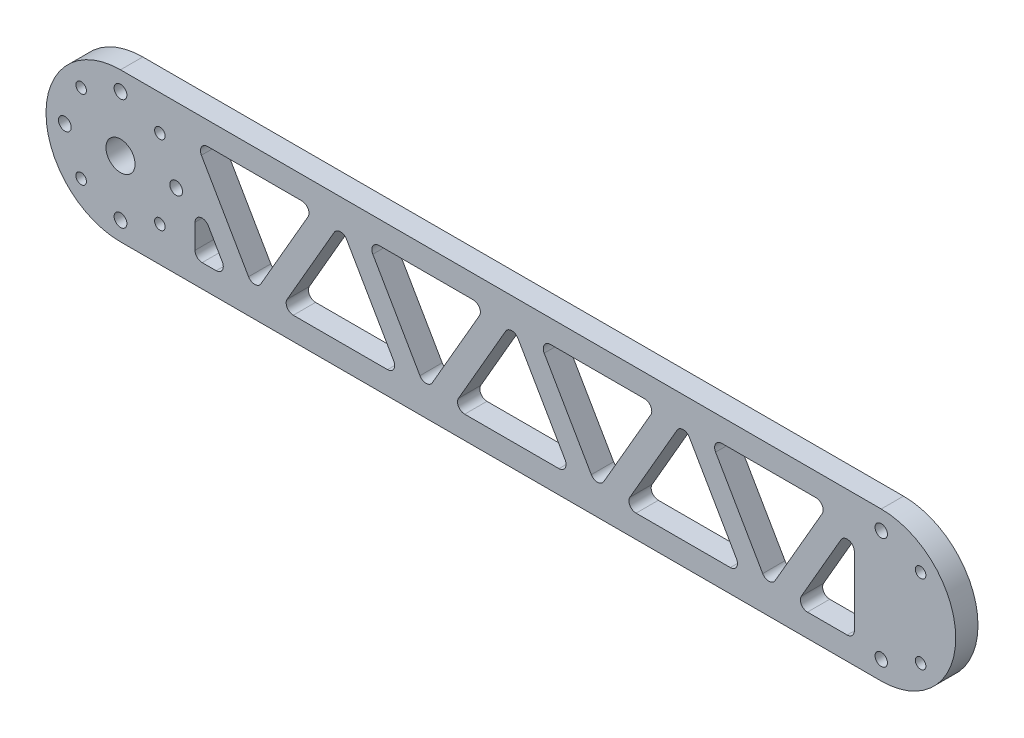
from build123d import *

# Parameters (mm, degrees)
SKETCH1_R              = 4
SKETCH1_R_2            = 1.75
SKETCH1_R_3            = 1.5
SKETCH1_R_4            = 1.8
BOSS_EXTRUDE1_DEPTH    = 6
CUT_EXTRUDE1_DEPTH     = 226.966811722
FILLET1_R              = 2
MOVE_FACE1_OUTLINE_R   = 4
MOVE_FACE1_OUTLINE_R_2 = 3.92
MOVE_FACE1_OUTLINE_R_3 = 1.75
MOVE_FACE1_OUTLINE_R_4 = 1.67
MOVE_FACE1_OUTLINE_R_5 = 1.5
MOVE_FACE1_OUTLINE_R_6 = 1.42
MOVE_FACE1_OUTLINE_R_7 = 1.8
MOVE_FACE1_OUTLINE_R_8 = 1.72
MOVE_FACE1_DEPTH       = 6


# Read off the part's stored shape, not the designer's step: Move Face1
with BuildPart() as part:
    # Sketch1 → Boss-Extrude1 (new body)
    with BuildSketch(Plane.XY):
        with BuildLine():
            Line((0, -20), (205, -20))
            ThreePointArc((205, -20), (225, 0), (205, 20))
            Line((205, 20), (0, 20))
            ThreePointArc((0, 20), (-20, 0), (0, -20))
        make_face()
        Circle(SKETCH1_R, mode=Mode.SUBTRACT)
        with Locations((205, -15)):
            Circle(SKETCH1_R_2, mode=Mode.SUBTRACT)
        with Locations((215.606601718, -10.606601718)):
            Circle(SKETCH1_R_3, mode=Mode.SUBTRACT)
        with Locations((205, 15)):
            Circle(SKETCH1_R_2, mode=Mode.SUBTRACT)
        with Locations((215.606601718, 10.606601718)):
            Circle(SKETCH1_R_3, mode=Mode.SUBTRACT)
        with Locations((0, -15)):
            Circle(SKETCH1_R_4, mode=Mode.SUBTRACT)
        with Locations((10.606601718, -10.606601718)):
            Circle(SKETCH1_R_3, mode=Mode.SUBTRACT)
        with Locations((-15, 0)):
            Circle(SKETCH1_R_4, mode=Mode.SUBTRACT)
        with Locations((-10.606601718, -10.606601718)):
            Circle(SKETCH1_R_3, mode=Mode.SUBTRACT)
        with Locations((0, 15)):
            Circle(SKETCH1_R_4, mode=Mode.SUBTRACT)
        with Locations((-10.606601718, 10.606601718)):
            Circle(SKETCH1_R_3, mode=Mode.SUBTRACT)
        with Locations((15, 0)):
            Circle(SKETCH1_R_4, mode=Mode.SUBTRACT)
        with Locations((10.606601718, 10.606601718)):
            Circle(SKETCH1_R_3, mode=Mode.SUBTRACT)
    extrude(amount=BOSS_EXTRUDE1_DEPTH)

    # Sketch2 → Cut-Extrude1 (cut, through all)
    with BuildSketch(Plane.XY.offset(6)):
        Polygon((20, 14), (52.331615075, 14), (36.165807537, -14), align=None)
        Polygon((43.094010768, -14), (59.259818305, 14), (75.425625842, -14), align=None)
        Polygon((66.188021535, 14), (82.353829072, -14), (98.51963661, 14), align=None)
        Polygon((89.282032303, -14), (105.44783984, 14), (121.613647377, -14), align=None)
        Polygon((112.37604307, 14), (128.541850608, -14), (144.707658145, 14), align=None)
        Polygon((20, 2), (20, -14), (29.237604307, -14), align=None)
        Polygon((135.470053838, -14), (151.635861375, 14), (167.801668913, -14), align=None)
        Polygon((174.729872143, -14), (158.564064606, 14), (190.89567968, 14), align=None)
        Polygon((181.658075373, -14), (197.82388291, 14), (197.82388291, -14), align=None)
    extrude(amount=-CUT_EXTRUDE1_DEPTH, mode=Mode.SUBTRACT)

    # Fillet1
    fillet1_edges = [part.edges().sort_by_distance(p)[0] for p in [
        (121.613647377, -14, 3),
        (89.282032303, -14, 3),
        (105.44783984, 14, 3),
        (112.37604307, 14, 3),
        (144.707658145, 14, 3),
        (128.541850608, -14, 3),
        (20, 2, 3),
        (29.237604307, -14, 3),
        (20, -14, 3),
        (167.801668913, -14, 3),
        (135.470053838, -14, 3),
        (151.635861375, 14, 3),
        (190.89567968, 14, 3),
        (174.729872143, -14, 3),
        (158.564064606, 14, 3),
        (197.82388291, -14, 3),
        (181.658075373, -14, 3),
        (197.82388291, 14, 3),
        (36.165807537, -14, 3),
        (20, 14, 3),
        (52.331615075, 14, 3),
        (75.425625842, -14, 3),
        (43.094010768, -14, 3),
        (59.259818305, 14, 3),
        (66.188021535, 14, 3),
        (98.51963661, 14, 3),
        (82.353829072, -14, 3),
    ]]
    fillet(fillet1_edges, radius=FILLET1_R)

    # Move Face1 outline → Move Face1 (add)
    # profile 1 of 23: a face of its own
    with BuildSketch(Plane.XY):
        with BuildLine():
            ThreePointArc((0, 20.08), (-20.08, 0), (0, -20.08))
            Line((0, -20.08), (205, -20.08))
            ThreePointArc((205, -20.08), (225.08, 0), (205, 20.08))
            Line((205, 20.08), (0, 20.08))
        make_face()
        with BuildLine():
            Line((205, -20), (0, -20))
            ThreePointArc((0, -20), (-20, 0), (0, 20))
            Line((0, 20), (205, 20))
            ThreePointArc((205, 20), (225, 0), (205, -20))
        make_face(mode=Mode.SUBTRACT)
    # profile 2 of 23: a face of its own
    with BuildSketch(Plane.XY):
        Circle(MOVE_FACE1_OUTLINE_R)
        Circle(MOVE_FACE1_OUTLINE_R_2, mode=Mode.SUBTRACT)
    # profile 3 of 23: a face of its own
    with BuildSketch(Plane.XY):
        with Locations((205, -15)):
            Circle(MOVE_FACE1_OUTLINE_R_3)
        with Locations((205, -15)):
            Circle(MOVE_FACE1_OUTLINE_R_4, mode=Mode.SUBTRACT)
    # profile 4 of 23: a face of its own
    with BuildSketch(Plane.XY):
        with Locations((215.606601718, -10.606601718)):
            Circle(MOVE_FACE1_OUTLINE_R_5)
        with Locations((215.606601718, -10.606601718)):
            Circle(MOVE_FACE1_OUTLINE_R_6, mode=Mode.SUBTRACT)
    # profile 5 of 23: a face of its own
    with BuildSketch(Plane.XY):
        with Locations((205, 15)):
            Circle(MOVE_FACE1_OUTLINE_R_3)
        with Locations((205, 15)):
            Circle(MOVE_FACE1_OUTLINE_R_4, mode=Mode.SUBTRACT)
    # profile 6 of 23: a face of its own
    with BuildSketch(Plane.XY):
        with Locations((215.606601718, 10.606601718)):
            Circle(MOVE_FACE1_OUTLINE_R_5)
        with Locations((215.606601718, 10.606601718)):
            Circle(MOVE_FACE1_OUTLINE_R_6, mode=Mode.SUBTRACT)
    # profile 7 of 23: a face of its own
    with BuildSketch(Plane.XY):
        with Locations((0, -15)):
            Circle(MOVE_FACE1_OUTLINE_R_7)
        with Locations((0, -15)):
            Circle(MOVE_FACE1_OUTLINE_R_8, mode=Mode.SUBTRACT)
    # profile 8 of 23: a face of its own
    with BuildSketch(Plane.XY):
        with Locations((10.606601718, -10.606601718)):
            Circle(MOVE_FACE1_OUTLINE_R_5)
        with Locations((10.606601718, -10.606601718)):
            Circle(MOVE_FACE1_OUTLINE_R_6, mode=Mode.SUBTRACT)
    # profile 9 of 23: a face of its own
    with BuildSketch(Plane.XY):
        with Locations((-15, 0)):
            Circle(MOVE_FACE1_OUTLINE_R_7)
        with Locations((-15, 0)):
            Circle(MOVE_FACE1_OUTLINE_R_8, mode=Mode.SUBTRACT)
    # profile 10 of 23: a face of its own
    with BuildSketch(Plane.XY):
        with Locations((-10.606601718, -10.606601718)):
            Circle(MOVE_FACE1_OUTLINE_R_5)
        with Locations((-10.606601718, -10.606601718)):
            Circle(MOVE_FACE1_OUTLINE_R_6, mode=Mode.SUBTRACT)
    # profile 11 of 23: a face of its own
    with BuildSketch(Plane.XY):
        with Locations((0, 15)):
            Circle(MOVE_FACE1_OUTLINE_R_7)
        with Locations((0, 15)):
            Circle(MOVE_FACE1_OUTLINE_R_8, mode=Mode.SUBTRACT)
    # profile 12 of 23: a face of its own
    with BuildSketch(Plane.XY):
        with Locations((-10.606601718, 10.606601718)):
            Circle(MOVE_FACE1_OUTLINE_R_5)
        with Locations((-10.606601718, 10.606601718)):
            Circle(MOVE_FACE1_OUTLINE_R_6, mode=Mode.SUBTRACT)
    # profile 13 of 23: a face of its own
    with BuildSketch(Plane.XY):
        with Locations((15, 0)):
            Circle(MOVE_FACE1_OUTLINE_R_7)
        with Locations((15, 0)):
            Circle(MOVE_FACE1_OUTLINE_R_8, mode=Mode.SUBTRACT)
    # profile 14 of 23: a face of its own
    with BuildSketch(Plane.XY):
        with Locations((10.606601718, 10.606601718)):
            Circle(MOVE_FACE1_OUTLINE_R_5)
        with Locations((10.606601718, 10.606601718)):
            Circle(MOVE_FACE1_OUTLINE_R_6, mode=Mode.SUBTRACT)
    # profile 15 of 23: a face of its own
    with BuildSketch(Plane.XY):
        with BuildLine():
            ThreePointArc((23.464101615, 14), (21.732050808, 13), (21.732050808, 11))
            Line((21.732050808, 11), (34.43375673, -11))
            ThreePointArc((34.43375673, -11), (36.165807538, -12), (37.897858345, -11))
            Line((37.897858345, -11), (50.599564267, 11))
            ThreePointArc((50.599564267, 11), (50.599564267, 13), (48.867513459, 14))
            Line((48.867513459, 14), (23.464101615, 14))
        make_face()
        with BuildLine():
            Line((34.503038762, -10.96), (21.80133284, 11.04))
            ThreePointArc((21.80133284, 11.04), (21.80133284, 12.96), (23.464101615, 13.92))
            Line((23.464101615, 13.92), (48.867513459, 13.92))
            ThreePointArc((48.867513459, 13.92), (50.530282235, 12.96), (50.530282235, 11.04))
            Line((50.530282235, 11.04), (37.828576313, -10.96))
            ThreePointArc((37.828576313, -10.96), (36.165807538, -11.92), (34.503038762, -10.96))
        make_face(mode=Mode.SUBTRACT)
    # profile 16 of 23: a face of its own
    with BuildSketch(Plane.XY):
        with BuildLine():
            ThreePointArc((96.787585802, 11), (96.787585802, 13), (95.055534995, 14))
            Line((95.055534995, 14), (69.65212315, 14))
            ThreePointArc((69.65212315, 14), (67.920072343, 13), (67.920072343, 11))
            Line((67.920072343, 11), (80.621778265, -11))
            ThreePointArc((80.621778265, -11), (82.353829072, -12), (84.08587988, -11))
            Line((84.08587988, -11), (96.787585802, 11))
        make_face()
        with BuildLine():
            Line((69.65212315, 13.92), (95.055534995, 13.92))
            ThreePointArc((95.055534995, 13.92), (96.71830377, 12.96), (96.71830377, 11.04))
            Line((96.71830377, 11.04), (84.016597848, -10.96))
            ThreePointArc((84.016597848, -10.96), (82.353829073, -11.92), (80.691060297, -10.96))
            Line((80.691060297, -10.96), (67.989354375, 11.04))
            ThreePointArc((67.989354375, 11.04), (67.989354375, 12.96), (69.65212315, 13.92))
        make_face(mode=Mode.SUBTRACT)
    # profile 17 of 23: a face of its own
    with BuildSketch(Plane.XY):
        with BuildLine():
            ThreePointArc((142.975607337, 11), (142.975607337, 13), (141.24355653, 14))
            Line((141.24355653, 14), (115.840144685, 14))
            ThreePointArc((115.840144685, 14), (114.108093878, 13), (114.108093878, 11))
            Line((114.108093878, 11), (126.8097998, -11))
            ThreePointArc((126.8097998, -11), (128.541850608, -12), (130.273901415, -11))
            Line((130.273901415, -11), (142.975607337, 11))
        make_face()
        with BuildLine():
            Line((115.840144685, 13.92), (141.24355653, 13.92))
            ThreePointArc((141.24355653, 13.92), (142.906325305, 12.96), (142.906325305, 11.04))
            Line((142.906325305, 11.04), (130.204619383, -10.96))
            ThreePointArc((130.204619383, -10.96), (128.541850608, -11.92), (126.879081832, -10.96))
            Line((126.879081832, -10.96), (114.17737591, 11.04))
            ThreePointArc((114.17737591, 11.04), (114.17737591, 12.96), (115.840144685, 13.92))
        make_face(mode=Mode.SUBTRACT)
    # profile 18 of 23: a face of its own
    with BuildSketch(Plane.XY):
        with BuildLine():
            ThreePointArc((189.163628873, 11), (189.163628873, 13), (187.431578065, 14))
            Line((187.431578065, 14), (162.028166221, 14))
            ThreePointArc((162.028166221, 14), (160.296115413, 13), (160.296115413, 11))
            Line((160.296115413, 11), (172.997821335, -11))
            ThreePointArc((172.997821335, -11), (174.729872142, -12), (176.46192295, -11))
            Line((176.46192295, -11), (189.163628873, 11))
        make_face()
        with BuildLine():
            Line((162.028166221, 13.92), (187.431578065, 13.92))
            ThreePointArc((187.431578065, 13.92), (189.09434684, 12.96), (189.09434684, 11.04))
            Line((189.09434684, 11.04), (176.392640918, -10.96))
            ThreePointArc((176.392640918, -10.96), (174.729872143, -11.92), (173.067103368, -10.96))
            Line((173.067103368, -10.96), (160.365397445, 11.04))
            ThreePointArc((160.365397445, 11.04), (160.365397445, 12.96), (162.028166221, 13.92))
        make_face(mode=Mode.SUBTRACT)
    # profile 19 of 23: a face of its own
    with BuildSketch(Plane.XY):
        with BuildLine():
            ThreePointArc((44.826061575, -11), (44.826061575, -13), (46.558112383, -14))
            Line((46.558112383, -14), (71.961524227, -14))
            ThreePointArc((71.961524227, -14), (73.693575035, -13), (73.693575035, -11))
            Line((73.693575035, -11), (60.991869112, 11))
            ThreePointArc((60.991869112, 11), (59.259818305, 12), (57.527767497, 11))
            Line((57.527767497, 11), (44.826061575, -11))
        make_face()
        with BuildLine():
            Line((71.961524227, -13.92), (46.558112383, -13.92))
            ThreePointArc((46.558112383, -13.92), (44.895343607, -12.96), (44.895343607, -11.04))
            Line((44.895343607, -11.04), (57.59704953, 10.96))
            ThreePointArc((57.59704953, 10.96), (59.259818305, 11.92), (60.92258708, 10.96))
            Line((60.92258708, 10.96), (73.624293002, -11.04))
            ThreePointArc((73.624293002, -11.04), (73.624293002, -12.96), (71.961524227, -13.92))
        make_face(mode=Mode.SUBTRACT)
    # profile 20 of 23: a face of its own
    with BuildSketch(Plane.XY):
        with BuildLine():
            ThreePointArc((91.01408311, -11), (91.01408311, -13), (92.746133918, -14))
            Line((92.746133918, -14), (118.149545762, -14))
            ThreePointArc((118.149545762, -14), (119.88159657, -13), (119.88159657, -11))
            Line((119.88159657, -11), (107.179890648, 11))
            ThreePointArc((107.179890648, 11), (105.44783984, 12), (103.715789032, 11))
            Line((103.715789032, 11), (91.01408311, -11))
        make_face()
        with BuildLine():
            Line((118.149545762, -13.92), (92.746133918, -13.92))
            ThreePointArc((92.746133918, -13.92), (91.083365143, -12.96), (91.083365143, -11.04))
            Line((91.083365143, -11.04), (103.785071065, 10.96))
            ThreePointArc((103.785071065, 10.96), (105.44783984, 11.92), (107.110608615, 10.96))
            Line((107.110608615, 10.96), (119.812314538, -11.04))
            ThreePointArc((119.812314538, -11.04), (119.812314538, -12.96), (118.149545762, -13.92))
        make_face(mode=Mode.SUBTRACT)
    # profile 21 of 23: a face of its own
    with BuildSketch(Plane.XY):
        with BuildLine():
            ThreePointArc((20, -12), (20.585786438, -13.414213562), (22, -14))
            Line((22, -14), (25.773502692, -14))
            ThreePointArc((25.773502692, -14), (27.505553499, -13), (27.505553499, -11))
            Line((27.505553499, -11), (23.732050808, -4.464101615))
            ThreePointArc((23.732050808, -4.464101615), (21.48236191, -3.532249963), (20, -5.464101615))
            Line((20, -5.464101615), (20, -12))
        make_face()
        with BuildLine():
            Line((25.773502692, -13.92), (22, -13.92))
            ThreePointArc((22, -13.92), (20.64235498, -13.35764502), (20.08, -12))
            Line((20.08, -12), (20.08, -5.464101615))
            ThreePointArc((20.08, -5.464101615), (21.503067433, -3.609524029), (23.662768775, -4.504101615))
            Line((23.662768775, -4.504101615), (27.436271467, -11.04))
            ThreePointArc((27.436271467, -11.04), (27.436271467, -12.96), (25.773502692, -13.92))
        make_face(mode=Mode.SUBTRACT)
    # profile 22 of 23: a face of its own
    with BuildSketch(Plane.XY):
        with BuildLine():
            ThreePointArc((137.202104645, -11), (137.202104645, -13), (138.934155453, -14))
            Line((138.934155453, -14), (164.337567297, -14))
            ThreePointArc((164.337567297, -14), (166.069618105, -13), (166.069618105, -11))
            Line((166.069618105, -11), (153.367912183, 11))
            ThreePointArc((153.367912183, 11), (151.635861376, 12), (149.903810568, 11))
            Line((149.903810568, 11), (137.202104645, -11))
        make_face()
        with BuildLine():
            Line((164.337567297, -13.92), (138.934155453, -13.92))
            ThreePointArc((138.934155453, -13.92), (137.271386678, -12.96), (137.271386678, -11.04))
            Line((137.271386678, -11.04), (149.9730926, 10.96))
            ThreePointArc((149.9730926, 10.96), (151.635861375, 11.92), (153.298630151, 10.96))
            Line((153.298630151, 10.96), (166.000336073, -11.04))
            ThreePointArc((166.000336073, -11.04), (166.000336073, -12.96), (164.337567297, -13.92))
        make_face(mode=Mode.SUBTRACT)
    # profile 23 of 23: a face of its own
    with BuildSketch(Plane.XY):
        with BuildLine():
            ThreePointArc((183.390126181, -11), (183.390126181, -13), (185.122176988, -14))
            Line((185.122176988, -14), (195.82388291, -14))
            ThreePointArc((195.82388291, -14), (197.238096473, -13.414213563), (197.82388291, -12))
            Line((197.82388291, -12), (197.82388291, 6.535898385))
            ThreePointArc((197.82388291, 6.535898385), (196.341521, 8.467750037), (194.091832103, 7.535898385))
            Line((194.091832103, 7.535898385), (183.390126181, -11))
        make_face()
        with BuildLine():
            Line((195.82388291, -13.92), (185.122176988, -13.92))
            ThreePointArc((185.122176988, -13.92), (183.459408213, -12.96), (183.459408213, -11.04))
            Line((183.459408213, -11.04), (194.161114135, 7.495898385))
            ThreePointArc((194.161114135, 7.495898385), (196.320815477, 8.390475971), (197.74388291, 6.535898385))
            Line((197.74388291, 6.535898385), (197.74388291, -12))
            ThreePointArc((197.74388291, -12), (197.18152793, -13.35764502), (195.82388291, -13.92))
        make_face(mode=Mode.SUBTRACT)
    extrude(amount=MOVE_FACE1_DEPTH)


solid = part.part
